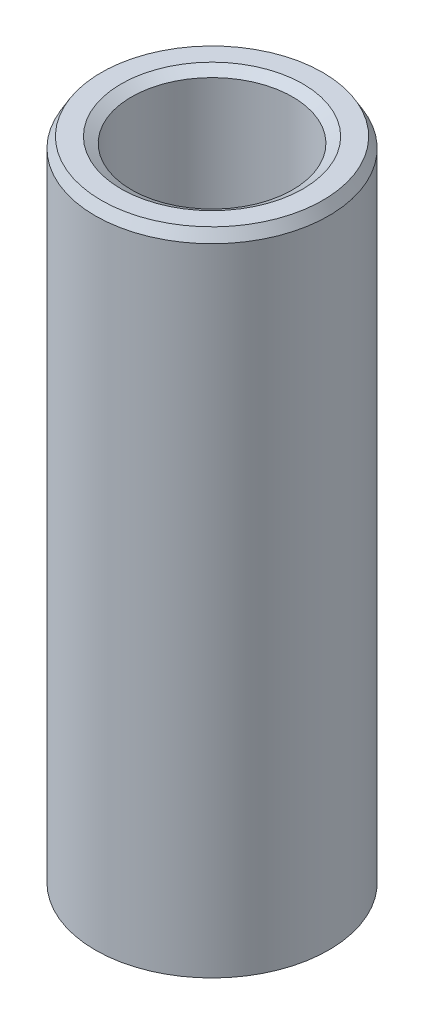
from build123d import *
from OCP.BRepFilletAPI import BRepFilletAPI_MakeChamfer

# Parameters (mm, degrees)
SKETCH1_R           = 40
BOSS_EXTRUDE1_DEPTH = 223.445164523
SKETCH2_R           = 27.595494445
CUT_EXTRUDE1_DEPTH  = 231.49455861
CHAMFER1_SIZE       = 3.562291364
CHAMFER1_SIZE2      = 2.056689878


with BuildPart() as part:
    # Sketch1 → Boss-Extrude1 (new body)
    with BuildSketch(Plane(origin=(0, 0, 0), x_dir=(1, 0, 0), z_dir=(0, 1, 0))):
        Circle(SKETCH1_R)
    extrude(amount=BOSS_EXTRUDE1_DEPTH)

    # Sketch2 → Cut-Extrude1 (cut, through all)
    with BuildSketch(Plane(origin=(0, 0, 0), x_dir=(1, 0, 0), z_dir=(0, 1, 0))):
        Circle(SKETCH2_R)
    extrude(amount=CUT_EXTRUDE1_DEPTH, mode=Mode.SUBTRACT)

    # Chamfer1: one chamfer whose edges measure the first distance from different faces: ONE call of the kernel's chamfer builder (chamfer() names one face for all edges)
    chamfer1_edges_1 = [part.edges().sort_by_distance(p)[0] for p in [
        (-27.595494445, 223.445164523, 0),
    ]]
    chamfer1_side_1 = [part.faces().sort_by_distance(p)[0] for p in [
        (-38.86862915, 223.445164523, 0),
    ]]
    chamfer1_edges_2 = [part.edges().sort_by_distance(p)[0] for p in [
        (-27.595494445, 0, 0),
    ]]
    chamfer1_side_2 = [part.faces().sort_by_distance(p)[0] for p in [
        (-27.595494445, 111.722582261, 0),
    ]]
    chamfer1_edges_3 = [part.edges().sort_by_distance(p)[0] for p in [
        (-40, 0, 0),
    ]]
    chamfer1_side_3 = [part.faces().sort_by_distance(p)[0] for p in [
        (-38.86862915, 0, 0),
    ]]
    chamfer1_edges_4 = [part.edges().sort_by_distance(p)[0] for p in [
        (-40, 223.445164523, 0),
    ]]
    chamfer1_side_4 = [part.faces().sort_by_distance(p)[0] for p in [
        (-40, 111.722582261, 0),
    ]]
    chamfer1 = BRepFilletAPI_MakeChamfer(part.part.solid().wrapped)
    for e in chamfer1_edges_1:
        chamfer1.Add(CHAMFER1_SIZE, CHAMFER1_SIZE2, e.wrapped, chamfer1_side_1[0].wrapped)  # the first distance lies on this face
    for e in chamfer1_edges_2:
        chamfer1.Add(CHAMFER1_SIZE, CHAMFER1_SIZE2, e.wrapped, chamfer1_side_2[0].wrapped)  # the first distance lies on this face
    for e in chamfer1_edges_3:
        chamfer1.Add(CHAMFER1_SIZE, CHAMFER1_SIZE2, e.wrapped, chamfer1_side_3[0].wrapped)  # the first distance lies on this face
    for e in chamfer1_edges_4:
        chamfer1.Add(CHAMFER1_SIZE, CHAMFER1_SIZE2, e.wrapped, chamfer1_side_4[0].wrapped)  # the first distance lies on this face
    add(Compound.cast(chamfer1.Shape()), mode=Mode.REPLACE)


solid = part.part
